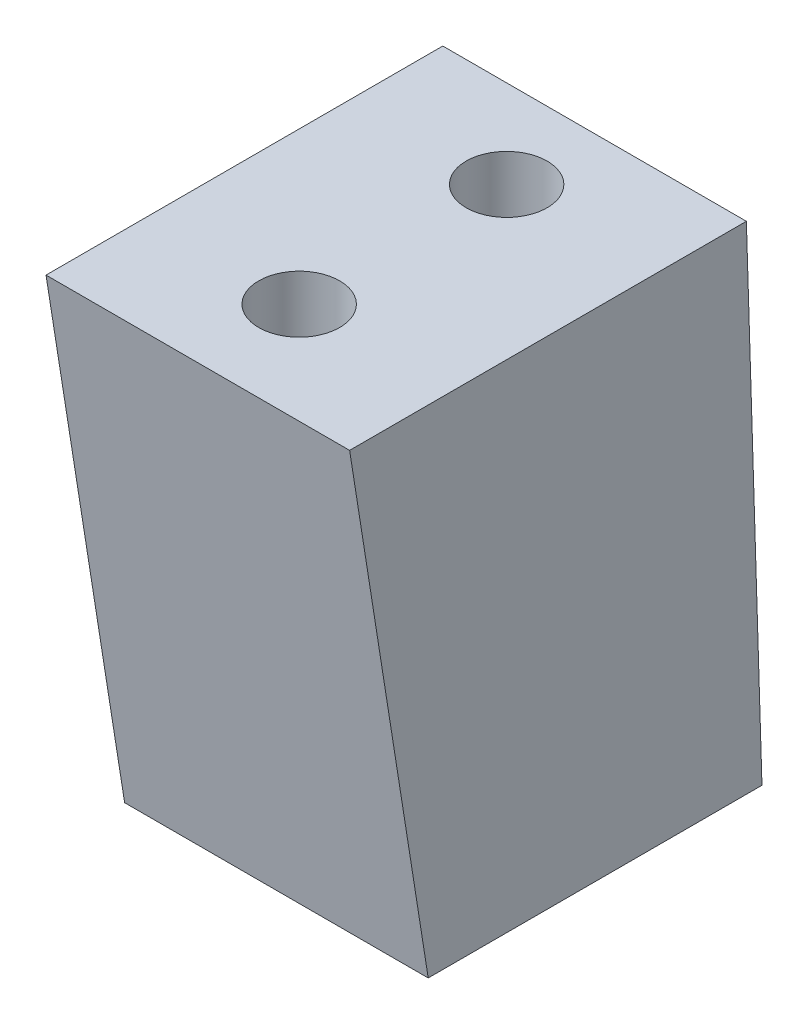
from build123d import *

# Parameters (mm, degrees)
ESQUISSE1_W             = 15
ESQUISSE1_H             = 24.52
BOSS_EXTRU_1_DEPTH      = 20.5
ENL_V_MAT_EXTRU_2_DEPTH = 3
ENL_V_START             = -3
ENL_V_MAT_EXTRU_1_DEPTH = 3
CHANFREIN2_SIZE         = 4
CHANFREIN2_SIZE_2       = 25.255006059
CHANFREIN3_SIZE         = 24.820002444
CHANFREIN3_SIZE_2       = 0.78


with BuildPart() as part:
    # Esquisse1 → Boss.-Extru.1 (new body)
    with BuildSketch(Plane.XY):
        with Locations((-7.5, 12.26)):
            Rectangle(ESQUISSE1_W, ESQUISSE1_H)
    extrude(amount=-BOSS_EXTRU_1_DEPTH)

    # Esquisse3 → Enlèv. mat.-Extru.2 (cut)
    with BuildSketch(Plane.XZ):
        with BuildLine():
            ThreePointArc((-5.5, -15.375), (-6.085786438, -13.960786438), (-7.5, -13.375))
            Line((-7.5, -13.375), (-7.5, -15.375))
            Line((-7.5, -15.375), (-7.5, -17.375))
            ThreePointArc((-7.5, -17.375), (-6.085786438, -16.789213562), (-5.5, -15.375))
        make_face()
        with BuildLine():
            Line((-7.5, -15.375), (-7.5, -13.375))
            ThreePointArc((-7.5, -13.375), (-9.5, -15.375), (-7.5, -17.375))
            Line((-7.5, -17.375), (-7.5, -15.375))
        make_face()
        with BuildLine():
            ThreePointArc((-7.5, -5.6875), (-9.5, -7.6875), (-7.5, -9.6875))
            Line((-7.5, -9.6875), (-7.5, -5.6875))
        make_face()
        with BuildLine():
            Line((-7.5, -5.6875), (-7.5, -9.6875))
            ThreePointArc((-7.5, -9.6875), (-6.085786438, -9.101713562), (-5.5, -7.6875))
            ThreePointArc((-5.5, -7.6875), (-6.085786438, -6.273286438), (-7.5, -5.6875))
        make_face()
    extrude(amount=-ENL_V_MAT_EXTRU_2_DEPTH, mode=Mode.SUBTRACT)

    # Esquisse2 → Enlèv. mat.-Extru.1 (cut)
    with BuildSketch(Plane(origin=(0, 24.52, 0), x_dir=(1, 0, 0), z_dir=(0, 1, 0)).offset(ENL_V_START)):
        with BuildLine():
            ThreePointArc((-7.5, 17.375), (-9.5, 15.375), (-7.5, 13.375))
            Line((-7.5, 13.375), (-7.5, 17.375))
        make_face()
        with BuildLine():
            Line((-7.5, 17.375), (-7.5, 13.375))
            ThreePointArc((-7.5, 13.375), (-6.085786438, 13.960786438), (-5.5, 15.375))
            ThreePointArc((-5.5, 15.375), (-6.085786438, 16.789213562), (-7.5, 17.375))
        make_face()
        with BuildLine():
            ThreePointArc((-5.5, 5.125), (-6.085786438, 6.539213562), (-7.5, 7.125))
            Line((-7.5, 7.125), (-7.5, 3.125))
            ThreePointArc((-7.5, 3.125), (-6.085786438, 3.710786438), (-5.5, 5.125))
        make_face()
        with BuildLine():
            Line((-7.5, 3.125), (-7.5, 7.125))
            ThreePointArc((-7.5, 7.125), (-9.5, 5.125), (-7.5, 3.125))
        make_face()
    extrude(amount=ENL_V_MAT_EXTRU_1_DEPTH, mode=Mode.SUBTRACT)

    # Chanfrein2
    # the kernel refuses this chamfer: 25.255006059, 4 mm, written as the material it takes off along each edge
    with BuildSketch(Plane(origin=(65.633111729, 0, 0), x_dir=(0, -0.2333366369919624, -0.9723960169793381), z_dir=(-1, 0, 0))) as chanfrein2_piece_1:
        Polygon((CHANFREIN2_SIZE * 0.972396016979, -CHANFREIN2_SIZE * 0.233336636992), (-CHANFREIN2_SIZE_2 * 0.233336636989, -CHANFREIN2_SIZE_2 * 0.972396016968), (0, 0), align=None)
    extrude(amount=146.266223457, mode=Mode.SUBTRACT)

    # Chanfrein3
    # the kernel refuses this chamfer: 24.820002444, 0.78 mm, written as the material it takes off along each edge
    with BuildSketch(Plane(origin=(-79.530828731, 24.52, -20.5), x_dir=(0, -0.999999270212902, -0.0012081281651260673), z_dir=(1, 0, 0))) as chanfrein3_piece_1:
        Polygon((CHANFREIN3_SIZE * 0.999999270211, -CHANFREIN3_SIZE * 0.00120812816512), (-CHANFREIN3_SIZE_2 * 0.00120812816513, -CHANFREIN3_SIZE_2 * 0.999999270213), (0, 0), align=None)
    extrude(amount=144.061657461, mode=Mode.SUBTRACT)


solid = part.part
